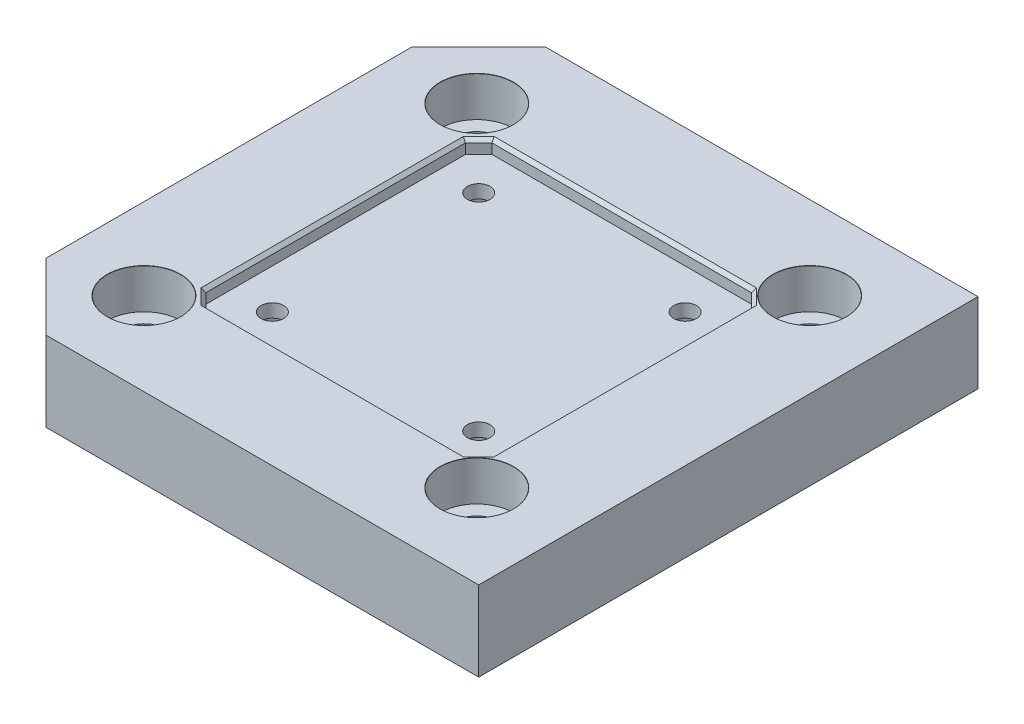
from build123d import *

# Parameters (mm, degrees)
BOSS_EXTRUDE1_DEPTH           = 12
CBORE_FOR_M6_SHCS1_AT_2_COUNT = 2
CBORE_FOR_M6_SHCS1_AT_2_PITCH = 50
CBORE_FOR_M6_SHCS1_AT_3_COUNT = 2
CBORE_FOR_M6_SHCS1_AT_3_PITCH = 70.710678119
CBORE_FOR_M6_SHCS1_AT_4_COUNT = 2
CBORE_FOR_M6_SHCS1_AT_4_PITCH = 50
CUT_EXTRUDE3_DEPTH            = 2
HOLE2_AT_2_COUNT              = 2
HOLE2_AT_2_PITCH              = 31
HOLE2_AT_3_COUNT              = 2
HOLE2_AT_3_PITCH              = 43.840620434
HOLE2_AT_4_COUNT              = 2
HOLE2_AT_4_PITCH              = 31
CHAMFER1_SIZE                 = 0.5
CHAMFER2_SIZE                 = 10


with BuildPart() as part:
    # Sketch1 → Boss-Extrude1 (new body)
    with BuildSketch(Plane(origin=(0, 0, 0), x_dir=(1, 0, 0), z_dir=(0, 1, 0))):
        Polygon((0, 37.5), (-37.5, 37.5), (-37.5, -37.5), (0, -37.5), (37.5, -37.5), (37.5, 37.5), align=None)
    extrude(amount=BOSS_EXTRUDE1_DEPTH)

    # Sketch14 → CBORE for M6 SHCS1 (revolve, cut)
    with BuildSketch(Plane(origin=(-25.29, 12, 25), x_dir=(0, 0, 1), z_dir=(1, 0, 0))):
        Polygon((0, 0), (0, 12), (3.325, 12), (3.3, 11.975), (3.3, 6), (5.5, 6), (5.5, 0.025), (5.525, 0), align=None)
    cbore_for_m6_shcs1 = revolve(axis=Axis((-25.29, 18.35, 25), (0, -1, 0)), mode=Mode.SUBTRACT)

    # CBORE for M6 SHCS1 at 2: CBORE for M6 SHCS1 ×2
    with Locations(*[(0, 0, -i * CBORE_FOR_M6_SHCS1_AT_2_PITCH) for i in range(1, CBORE_FOR_M6_SHCS1_AT_2_COUNT)]):
        add(cbore_for_m6_shcs1, mode=Mode.SUBTRACT)

    # CBORE for M6 SHCS1 at 3: CBORE for M6 SHCS1 ×2
    with Locations(*[Vector(0.7071067811865476, 0, -0.7071067811865476) * (i * CBORE_FOR_M6_SHCS1_AT_3_PITCH) for i in range(1, CBORE_FOR_M6_SHCS1_AT_3_COUNT)]):
        add(cbore_for_m6_shcs1, mode=Mode.SUBTRACT)

    # CBORE for M6 SHCS1 at 4: CBORE for M6 SHCS1 ×2
    with Locations(*[(i * CBORE_FOR_M6_SHCS1_AT_4_PITCH, 0, 0) for i in range(1, CBORE_FOR_M6_SHCS1_AT_4_COUNT)]):
        add(cbore_for_m6_shcs1, mode=Mode.SUBTRACT)

    # Sketch9 → Cut-Extrude3 (cut)
    with BuildSketch(Plane(origin=(0, 12, 0), x_dir=(1, 0, 0), z_dir=(0, 1, 0))):
        Polygon((21.5, 19.5), (19.5, 21.5), (-19.5, 21.5), (-21.5, 19.5), (-21.5, -19.5), (-19.5, -21.5), (19.5, -21.5), (21.5, -19.5), align=None)
    extrude(amount=-CUT_EXTRUDE3_DEPTH, mode=Mode.SUBTRACT)

    # Sketch12 → Hole2 (revolve, cut)
    with BuildSketch(Plane(origin=(-15.5, 0, -15.5), x_dir=(0, 0, -1), z_dir=(1, 0, 0))):
        Polygon((0, 0), (0, 12), (1.725, 12), (1.7, 11.975), (1.7, 8), (3.25, 8), (3.25, 0.025), (3.275, 0), align=None)
    hole2 = revolve(axis=Axis((-15.5, -6.35, -15.5), (0, 1, 0)), mode=Mode.SUBTRACT)

    # Hole2 at 2: Hole2 ×2
    with Locations(*[(i * HOLE2_AT_2_PITCH, 0, 0) for i in range(1, HOLE2_AT_2_COUNT)]):
        add(hole2, mode=Mode.SUBTRACT)

    # Hole2 at 3: Hole2 ×2
    with Locations(*[Vector(0.7071067811865476, 0, 0.7071067811865475) * (i * HOLE2_AT_3_PITCH) for i in range(1, HOLE2_AT_3_COUNT)]):
        add(hole2, mode=Mode.SUBTRACT)

    # Hole2 at 4: Hole2 ×2
    with Locations(*[(0, 0, i * HOLE2_AT_4_PITCH) for i in range(1, HOLE2_AT_4_COUNT)]):
        add(hole2, mode=Mode.SUBTRACT)

    # Chamfer1
    chamfer1_edges = [part.edges().sort_by_distance(p)[0] for p in [
        (20.5, 12, 20.5),
        (21.5, 12, 0),
        (20.5, 12, -20.5),
        (0, 12, 21.5),
        (-20.5, 12, 20.5),
        (-21.5, 12, 0),
        (-20.5, 12, -20.5),
        (0, 12, -21.5),
    ]]
    chamfer(chamfer1_edges, length=CHAMFER1_SIZE)

    # Chamfer2
    chamfer2_edges = [part.edges().sort_by_distance(p)[0] for p in [
        (-37.5, 6, 37.5),
        (-37.5, 6, -37.5),
    ]]
    chamfer(chamfer2_edges, length=CHAMFER2_SIZE)


solid = part.part
